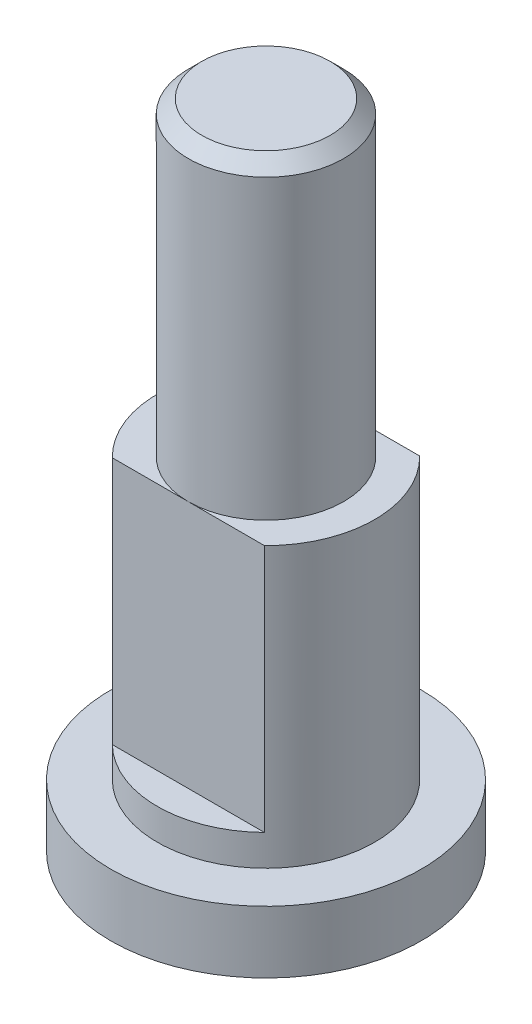
from build123d import *

# Parameters (mm, degrees)
CUT_EXTRUDE_1_DEPTH = 8
EXTRUDE_START       = 7
SKETCH_3_R          = 2.5
EXTRUDE_1_DEPTH     = 7


# Read off the part's stored shape, not the designer's step: M5 机械螺纹 螺柱1
with BuildPart() as part:
    # Sketch 1 → 旋转1 (revolve)
    with BuildSketch(Plane.XY, mode=Mode.PRIVATE) as revolve_1_sk:
        Polygon((5, 9), (5, -2), (10, -2), (10, 0), (8.5, 0), (8.5, 9), align=None)
    revolve(revolve_1_sk.sketch.rotate(Axis((5, -2, 0), (0, 1, 0)), 90), axis=Axis((5, -2, 0), (0, 1, 0)))

    # Sketch 2 → 切除-拉伸1 (cut)
    with BuildSketch(Plane(origin=(0, 9, 0), x_dir=(1, 0, 0), z_dir=(0, 1, 0))):
        with BuildLine():
            ThreePointArc((7.449489743, 2.5), (5, 3.5), (2.550510257, 2.5))
            Line((2.550510257, 2.5), (7.449489743, 2.5))
        make_face()
        with BuildLine():
            Line((7.449489743, -2.5), (2.550510257, -2.5))
            ThreePointArc((2.550510257, -2.5), (5, -3.5), (7.449489743, -2.5))
        make_face()
    extrude(amount=-CUT_EXTRUDE_1_DEPTH, mode=Mode.SUBTRACT)

    # M5 机械螺纹 螺柱1 outline → M5 机械螺纹 螺柱1 (revolve)
    with BuildSketch(Plane(origin=(5, 0, 0), x_dir=(1, 0, 0), z_dir=(0, 0, 1))):
        Polygon((2.067, 19), (0, 19), (0, 9), (2.5, 9), (2.5, 18.567), align=None)
    revolve(axis=Axis((5, 0, 0), (0, 1, 0)))

    # 草图3 → 凸台-拉伸1 (add)
    with BuildSketch(Plane(origin=(0, 9, 0), x_dir=(1, 0, 0), z_dir=(0, 1, 0)).offset(EXTRUDE_START)):
        with Locations(Location((5, 0, 0), (0, 0, 90))):
            Circle(SKETCH_3_R)
    extrude(amount=-EXTRUDE_1_DEPTH)


solid = part.part
